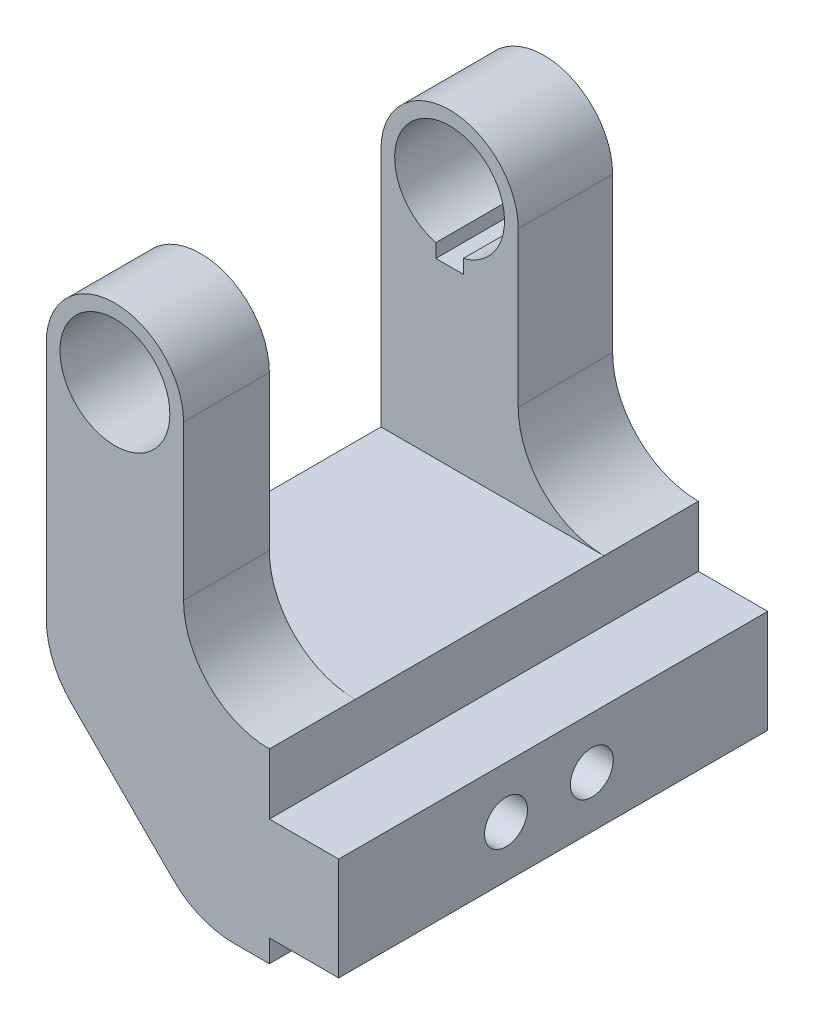
from build123d import *

# Parameters (mm, degrees)
SKETCH1_R               = 12
SKETCH1_R_2             = 6.4
BOSS_EXTRUDE1_DEPTH     = 50
CUT_EXTRUDE1_DEPTH      = 53.80151513
CUT_EXTRUDE1_DEPTH_BACK = 53.80151513
SKETCH2_R               = 12
SKETCH2_R_2             = 8
BOSS_EXTRUDE2_DEPTH     = 50
SKETCH4_W               = 29
SKETCH4_H               = 42.03410999
CUT_EXTRUDE2_DEPTH      = 79.288280436
CUT_EXTRUDE6_DEPTH      = 79.288280436
CUT_EXTRUDE6_DEPTH_BACK = 79.288280436
SKETCH8_R               = 2.5
CUT_EXTRUDE9_START      = -10
CUT_EXTRUDE9_DEPTH      = 20
SKETCH10_W              = 3.2
SKETCH10_H              = 1.6
CUT_EXTRUDE10_DEPTH     = 20
FILLET1_R               = 10


with BuildPart() as part:
    # Sketch1 → Boss-Extrude1 (new body)
    with BuildSketch(Plane.XY):
        Circle(SKETCH1_R)
        Circle(SKETCH1_R_2, mode=Mode.SUBTRACT)
    extrude(amount=BOSS_EXTRUDE1_DEPTH)

    # Sketch2 → Cut-Extrude1 (cut, two sides: drawn at the far end of the back side and taken through both)
    with BuildSketch(Plane.XY.offset(50).offset(-CUT_EXTRUDE1_DEPTH_BACK)):
        Circle(SKETCH2_R)
        Circle(SKETCH2_R_2, mode=Mode.SUBTRACT)
    extrude(amount=CUT_EXTRUDE1_DEPTH + CUT_EXTRUDE1_DEPTH_BACK, mode=Mode.SUBTRACT)

    # Sketch3 → Boss-Extrude2 (add, through all)
    with BuildSketch(Plane.XY.offset(50)):
        with BuildLine():
            Line((-8, 0), (-8, -32))
            Line((-8, -32), (9.67766953, -49.67766953))
            Line((9.67766953, -49.67766953), (18, -49.67766953))
            Line((18, -49.67766953), (18, -47.076150072))
            Line((18, -47.076150072), (26.076150072, -47.076150072))
            Line((26.076150072, -47.076150072), (26.076150072, -35.076150072))
            Line((26.076150072, -35.076150072), (18, -35.076150072))
            Line((18, -35.076150072), (18, -28))
            Line((18, -28), (8, -28))
            Line((8, -28), (8, 0))
            ThreePointArc((8, 0), (0, -8), (-8, 0))
        make_face()
    extrude(amount=-BOSS_EXTRUDE2_DEPTH)

    # Sketch4 → Cut-Extrude2 (cut, through all)
    with BuildSketch(Plane(origin=(26.076150072, 0, 0), x_dir=(0, 0, -1), z_dir=(1, 0, 0))):
        with Locations((-25.5, -6.982945005)):
            Rectangle(SKETCH4_W, SKETCH4_H)
    extrude(amount=-CUT_EXTRUDE2_DEPTH, mode=Mode.SUBTRACT)

    # Sketch8 → Cut-Extrude6 (cut, two sides: drawn at the far end of the back side and taken through both)
    with BuildSketch(Plane(origin=(26.076150072, 0, 0), x_dir=(0, 0, -1), z_dir=(1, 0, 0)).offset(-CUT_EXTRUDE6_DEPTH_BACK)):
        with Locations(Location((-30.5, -41.076150072, 0), (0, 0, 90))):
            Circle(SKETCH8_R)
        with Locations(Location((-20.5, -41.076150072, 0), (0, 0, 90))):
            Circle(SKETCH8_R)
    extrude(amount=CUT_EXTRUDE6_DEPTH + CUT_EXTRUDE6_DEPTH_BACK, mode=Mode.SUBTRACT)

    # Sketch9 → Cut-Extrude9 (cut)
    with BuildSketch(Plane(origin=(26.076150072, 0, 0), x_dir=(0, 0, -1), z_dir=(1, 0, 0)).offset(CUT_EXTRUDE9_START)):
        with BuildLine():
            Line((-20.5, -36.076150072), (-30.5, -36.076150072))
            ThreePointArc((-30.5, -36.076150072), (-35.5, -41.076150072), (-30.5, -46.076150072))
            Line((-30.5, -46.076150072), (-20.5, -46.076150072))
            ThreePointArc((-20.5, -46.076150072), (-15.5, -41.076150072), (-20.5, -36.076150072))
        make_face()
    extrude(amount=-CUT_EXTRUDE9_DEPTH, mode=Mode.SUBTRACT)

    # Sketch10 → Cut-Extrude10 (cut)
    with BuildSketch(Plane(origin=(0, 0, 0), x_dir=(-1, 0, 0), z_dir=(0, 0, -1))):
        with Locations((0, -6.996773354)):
            Rectangle(SKETCH10_W, SKETCH10_H)
    extrude(amount=-CUT_EXTRUDE10_DEPTH, mode=Mode.SUBTRACT)

    # Fillet1
    # the kernel refuses this fillet: 10 mm, written as the material it adds along each edge
    with BuildSketch(Plane(origin=(8, -28, 11), x_dir=(0, 1, 0), z_dir=(0, 0, -1))) as fillet1_piece_1:
        with BuildLine():
            CenterArc((FILLET1_R, FILLET1_R), FILLET1_R, 180, 90)
            Line((0, FILLET1_R), (0, 0))
            Line((0, 0), (FILLET1_R, 0))
        make_face()
    extrude(amount=11)
    with BuildSketch(Plane(origin=(8, -28, 50), x_dir=(1, 0, 0), z_dir=(0, 0, -1))) as fillet1_piece_2:
        with BuildLine():
            CenterArc((FILLET1_R, -FILLET1_R), FILLET1_R, 90, 90)
            Line((0, -FILLET1_R), (0, 0))
            Line((0, 0), (FILLET1_R, 0))
        make_face()
    extrude(amount=10)
    # the kernel refuses this fillet: 10 mm, written as the material it takes off along each edge
    with BuildSketch(Plane(origin=(-8, -32, 60.355339059), x_dir=(0.7071067811865476, -0.7071067811865474, 0), z_dir=(0, 0, -1)), Plane(origin=(9.67766953, -49.67766953, 60.355339059), x_dir=(1, 0, 0), z_dir=(0, 0, -1))) as fillet1_2_piece_1:
        with BuildLine():
            CenterArc((FILLET1_R * 0.414213562373, -FILLET1_R), FILLET1_R, 90, 45)
            Line((-FILLET1_R * 0.292893218813, -FILLET1_R * 0.292893218813), (0, 0))
            Line((0, 0), (FILLET1_R * 0.414213562373, 0))
        make_face()
    extrude(amount=70.710678119, mode=Mode.SUBTRACT)


solid = part.part
